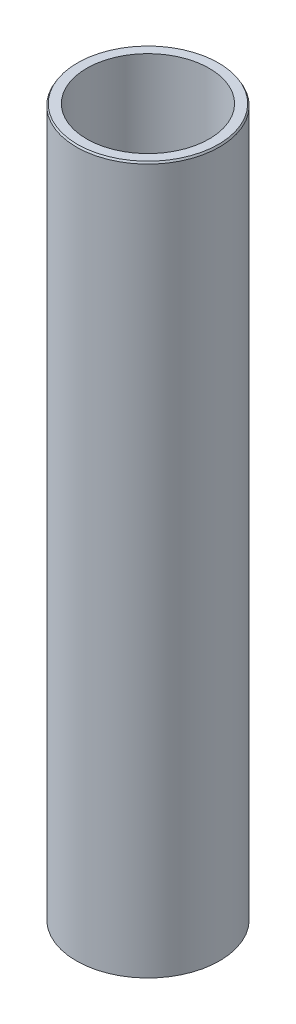
from build123d import *
from OCP.BRepFilletAPI import BRepFilletAPI_MakeChamfer

# Parameters (mm, degrees)
SKETCH1_R           = 52.5
BOSS_EXTRUDE1_DEPTH = 518.875283416
SKETCH2_R           = 44.920797073
CUT_EXTRUDE1_DEPTH  = 525.160337817
CHAMFER1_SIZE       = 1.323144647
CHAMFER1_SIZE2      = 0.763917918


with BuildPart() as part:
    # Sketch1 → Boss-Extrude1 (new body)
    with BuildSketch(Plane(origin=(0, 0, 0), x_dir=(1, 0, 0), z_dir=(0, 1, 0))):
        Circle(SKETCH1_R)
    extrude(amount=BOSS_EXTRUDE1_DEPTH)

    # Sketch2 → Cut-Extrude1 (cut, through all)
    with BuildSketch(Plane(origin=(0, 0, 0), x_dir=(1, 0, 0), z_dir=(0, 1, 0))):
        Circle(SKETCH2_R)
    extrude(amount=CUT_EXTRUDE1_DEPTH, mode=Mode.SUBTRACT)

    # Chamfer1: one chamfer whose edges measure the first distance from different faces: ONE call of the kernel's chamfer builder (chamfer() names one face for all edges)
    chamfer1_edges_1 = [part.edges().sort_by_distance(p)[0] for p in [
        (-52.5, 518.875283416, 0),
    ]]
    chamfer1_side_1 = [part.faces().sort_by_distance(p)[0] for p in [
        (-52.5, 259.437641708, 0),
    ]]
    chamfer1_edges_2 = [part.edges().sort_by_distance(p)[0] for p in [
        (-52.5, 0, 0),
    ]]
    chamfer1_side_2 = [part.faces().sort_by_distance(p)[0] for p in [
        (-51.01507576, 0, 0),
    ]]
    chamfer1 = BRepFilletAPI_MakeChamfer(part.part.solid().wrapped)
    for e in chamfer1_edges_1:
        chamfer1.Add(CHAMFER1_SIZE, CHAMFER1_SIZE2, e.wrapped, chamfer1_side_1[0].wrapped)  # the first distance lies on this face
    for e in chamfer1_edges_2:
        chamfer1.Add(CHAMFER1_SIZE, CHAMFER1_SIZE2, e.wrapped, chamfer1_side_2[0].wrapped)  # the first distance lies on this face
    add(Compound.cast(chamfer1.Shape()), mode=Mode.REPLACE)


solid = part.part
